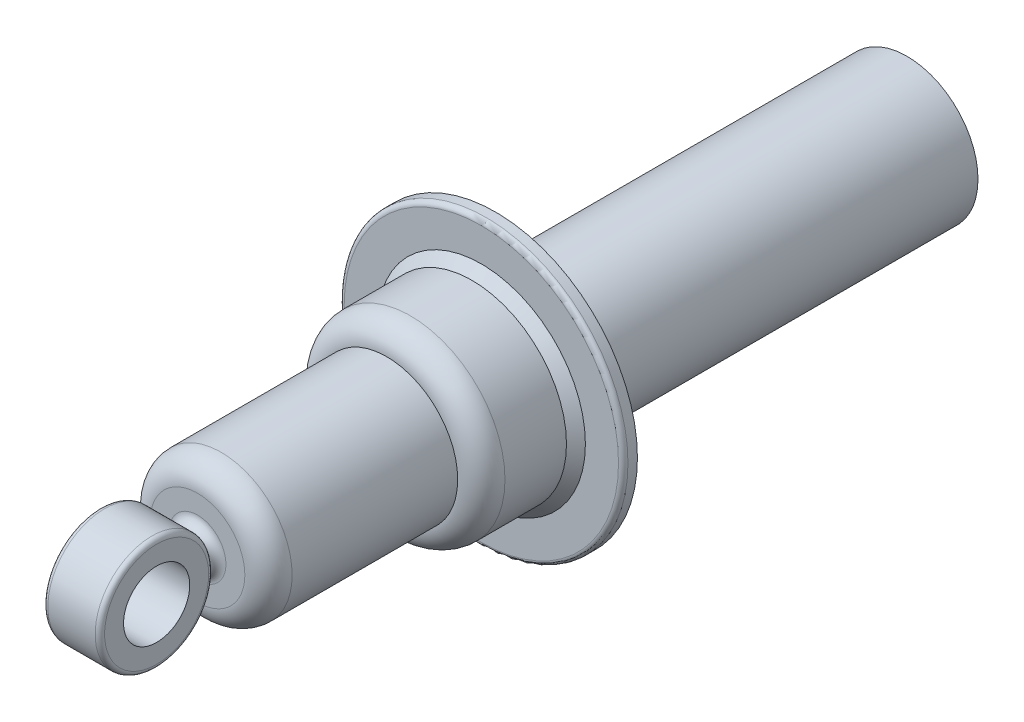
from build123d import *

# Parameters (mm, degrees)
SKETCH1_W           = 7.5
SKETCH1_H           = 84
FILLET1_R           = 1
FILLET2_R           = 5
FILLET3_R           = 1
CHAMFER1_SIZE       = 2
SKETCH2_R           = 12
SKETCH2_R_2         = 7
BOSS_EXTRUDE1_DEPTH = 6
FILLET5_R           = 1


with BuildPart() as part:
    # Sketch1 → Revolve1 (revolve)
    with BuildSketch(Plane.YZ, mode=Mode.PRIVATE) as revolve1_sk:
        Polygon((15, 63), (0, 63), (0, 3), (7.5, 3), (7.5, 0), (20, 0), (30, 0), (30, 3), (20, 3), (20, 23), (15, 23), align=None)
        with Locations((11.25, -45)):
            Rectangle(SKETCH1_W, SKETCH1_H)
        Polygon((20, 0), (7.5, 0), (7.5, -3), (15, -3), (20, -3), align=None)
    revolve(revolve1_sk.sketch.rotate(Axis((0, 0, 71.795433958), (0, 0, -1)), 90), axis=Axis((0, 0, 71.795433958), (0, 0, -1)))

    # Fillet1
    fillet1_edges = [part.edges().sort_by_distance(p)[0] for p in [
        (-7.5, 0, -87),
    ]]
    fillet(fillet1_edges, radius=FILLET1_R)

    # Fillet2
    fillet2_edges = [part.edges().sort_by_distance(p)[0] for p in [
        (-15, 0, 63),
        (-20, 0, 23),
    ]]
    fillet(fillet2_edges, radius=FILLET2_R - 0.0001)  # a hair under: the kernel refuses the full size

    # Fillet3
    fillet3_edges = [part.edges().sort_by_distance(p)[0] for p in [
        (-30, 0, 3),
    ]]
    fillet(fillet3_edges, radius=FILLET3_R)

    # Chamfer1
    chamfer1_edges = [part.edges().sort_by_distance(p)[0] for p in [
        (-20, 0, 3),
    ]]
    chamfer(chamfer1_edges, length=CHAMFER1_SIZE)



with BuildPart() as body_2:
    # Sketch2 → Boss-Extrude1 (new, symmetric)
    with BuildSketch(Plane.YZ):
        with Locations(Location((0, 77.649110641, 0), (0, 0, 270))):
            Circle(SKETCH2_R)
        with Locations(Location((0, 77.649110641, 0), (0, 0, 270))):
            Circle(SKETCH2_R_2, mode=Mode.SUBTRACT)
    extrude(amount=BOSS_EXTRUDE1_DEPTH, both=True)


with BuildPart() as part_1:
    add(part.part)

    add(body_2.part)  # Revolve2 merges body 2
    # Sketch2<3> → Revolve2 (revolve)
    with BuildSketch(Plane.YZ, mode=Mode.PRIVATE) as revolve2_sk:
        with BuildLine():
            Line((0, 65.649110641), (0, 63))
            Line((0, 63), (6, 63))
            ThreePointArc((6, 63), (4.048842445, 64.560700337), (5.142857143, 66.807015806))
            ThreePointArc((5.142857143, 66.807015806), (2.63579798, 65.942165309), (0, 65.649110641))
        make_face()
    revolve(revolve2_sk.sketch.rotate(Axis((0, 0, 0), (0, 0, 1)), 270), axis=Axis((0, 0, 0), (0, 0, 1)))

    # Fillet5
    fillet5_edges = [part_1.edges().sort_by_distance(p)[0] for p in [
        (-6, 0, 89.649110641),
        (6, 0, 89.649110641),
    ]]
    fillet(fillet5_edges, radius=FILLET5_R)


solid = part_1.part
